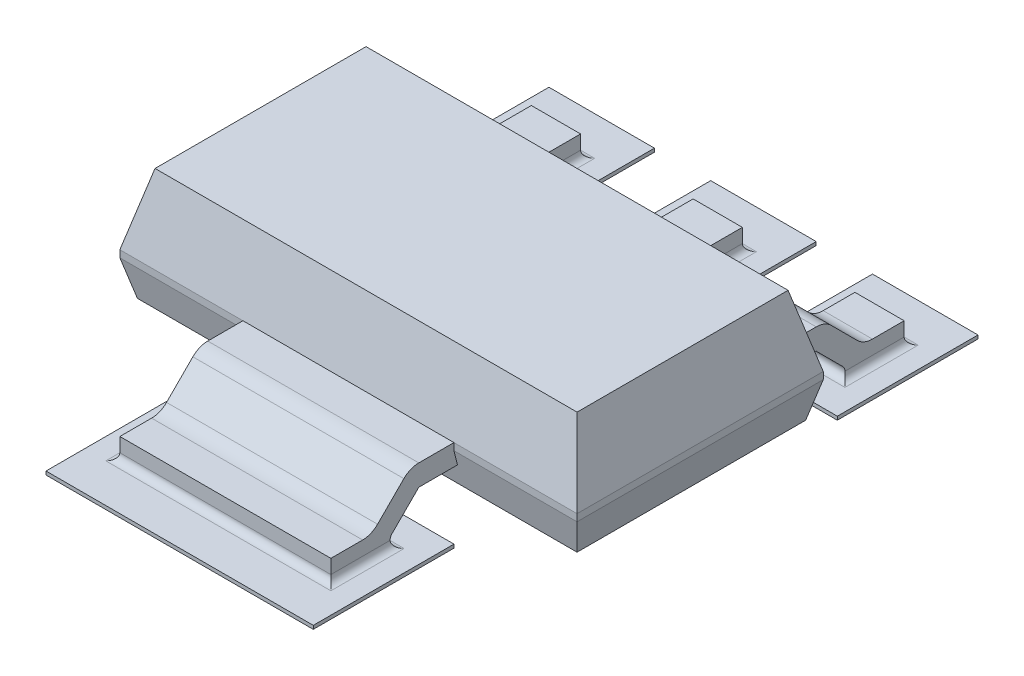
from build123d import *
from OCP.BRepFilletAPI import BRepFilletAPI_MakeChamfer

# Parameters (mm, degrees)
BOSS_EXTRUDE1_DEPTH   = 1.6
CHAMFER1_SIZE         = 1
CHAMFER1_SIZE2        = 0.25
CHAMFER2_SIZE         = 0.125
CHAMFER2_SIZE2        = 0.5
EXTRUDE_THIN1_DEPTH   = 1.5
EXTRUDE_THIN2_DEPTH   = 0.35
BOSS_EXTRUDE2_DEPTH   = 0.05
FILLET1_R             = 0.1
FILLET2_R             = 0.1
LPATTERN1_START       = -2.75
LPATTERN1_DEPTH       = 0.9
LPATTERN1_START_2     = -3.05
LPATTERN1_2_OUTLINE_W = 0.04999999999999999
LPATTERN1_2_OUTLINE_H = 2.0000000000000004
LPATTERN1_2_DEPTH     = 1.5
LPATTERN1_START_3     = -5
LPATTERN1_3_DEPTH     = 5
LPATTERN1_START_4     = -0.45
LPATTERN1_4_DEPTH     = 0.9
LPATTERN1_START_5     = -0.75
LPATTERN1_5_OUTLINE_W = 0.04999999999999999
LPATTERN1_5_OUTLINE_H = 2.0000000000000004
LPATTERN1_5_DEPTH     = 1.5
LPATTERN1_6_DEPTH     = 5
INDENT1_START         = -1.5
INDENT1_DEPTH         = 3
INDENT1_START_2       = -2.65
INDENT1_2_DEPTH       = 0.7
INDENT1_START_3       = -0.35
INDENT1_3_DEPTH       = 0.7
INDENT1_START_4       = 1.95
INDENT1_4_DEPTH       = 0.7


with BuildPart() as part:
    # Sketch1 → Boss-Extrude1 (new body)
    with BuildSketch(Plane(origin=(0, 0, 0), x_dir=(1, 0, 0), z_dir=(0, 1, 0))):
        Polygon((-3.2500000000000004, 1.7500000000000002), (3.2499999999999996, 1.7500000000000002), (3.25, -1.75), (-3.2500000000000004, -1.749999999999998), align=None)
    extrude(amount=BOSS_EXTRUDE1_DEPTH)

    # Chamfer1: one chamfer whose edges measure the first distance from different faces: ONE call of the kernel's chamfer builder (chamfer() names one face for all edges)
    chamfer1_edges_1 = [part.edges().sort_by_distance(p)[0] for p in [
        (-3.2500000000000004, 1.6, -1.11e-15),
    ]]
    chamfer1_side_1 = [part.faces().sort_by_distance(p)[0] for p in [
        (-3.2500000000000004, 0.8, -1.17e-15),
    ]]
    chamfer1_edges_2 = [part.edges().sort_by_distance(p)[0] for p in [
        (0, 1.6, 1.7499999999999991),
    ]]
    chamfer1_side_2 = [part.faces().sort_by_distance(p)[0] for p in [
        (-6e-17, 0.8, 1.7499999999999991),
    ]]
    chamfer1_edges_3 = [part.edges().sort_by_distance(p)[0] for p in [
        (3.25, 1.6, -2.2e-16),
    ]]
    chamfer1_side_3 = [part.faces().sort_by_distance(p)[0] for p in [
        (3.25, 0.8, -1.6e-16),
    ]]
    chamfer1_edges_4 = [part.edges().sort_by_distance(p)[0] for p in [
        (-4.4e-16, 1.6, -1.7500000000000002),
    ]]
    chamfer1_side_4 = [part.faces().sort_by_distance(p)[0] for p in [
        (-4.3e-16, 0.8, -1.7500000000000002),
    ]]
    chamfer1 = BRepFilletAPI_MakeChamfer(part.part.solid().wrapped)
    for e in chamfer1_edges_1:
        chamfer1.Add(CHAMFER1_SIZE, CHAMFER1_SIZE2, e.wrapped, chamfer1_side_1[0].wrapped)  # the first distance lies on this face
    for e in chamfer1_edges_2:
        chamfer1.Add(CHAMFER1_SIZE, CHAMFER1_SIZE2, e.wrapped, chamfer1_side_2[0].wrapped)  # the first distance lies on this face
    for e in chamfer1_edges_3:
        chamfer1.Add(CHAMFER1_SIZE, CHAMFER1_SIZE2, e.wrapped, chamfer1_side_3[0].wrapped)  # the first distance lies on this face
    for e in chamfer1_edges_4:
        chamfer1.Add(CHAMFER1_SIZE, CHAMFER1_SIZE2, e.wrapped, chamfer1_side_4[0].wrapped)  # the first distance lies on this face
    add(Compound.cast(chamfer1.Shape()), mode=Mode.REPLACE)

    # Chamfer2
    chamfer2_edges = [part.edges().sort_by_distance(p)[0] for p in [
        (0, 0, 1.7499999999999991),
        (-3.2500000000000004, 0, -1.11e-15),
        (-4.4e-16, 0, -1.7500000000000002),
        (3.25, 0, -2.2e-16),
    ]]
    chamfer2_side = [part.faces().sort_by_distance(p)[0] for p in [
        (4e-17, 0, -5.8e-16),
    ]]
    chamfer(chamfer2_edges, length=CHAMFER2_SIZE, length2=CHAMFER2_SIZE2, reference=chamfer2_side[0])

    # Indent1: read off the stored shape, not the designer's step
    # Indent1 outline → Indent1 (cut)
    with BuildSketch(Plane.YZ.offset(INDENT1_START)):
        Polygon((0.3, 0), (0.6, 0), (0.6, 1.75), (0.5, 1.75), (0.3, 1.7), align=None)
    extrude(amount=INDENT1_DEPTH, mode=Mode.SUBTRACT)

    # Indent1 2 outline → Indent1 2 (cut)
    with BuildSketch(Plane.YZ.offset(INDENT1_START_2)):
        Polygon((0.5, -1.75), (0.6, -1.75), (0.6, 0), (0.3, 0), (0.3, -1.7), align=None)
    extrude(amount=INDENT1_2_DEPTH, mode=Mode.SUBTRACT)

    # Indent1 3 outline → Indent1 3 (cut)
    with BuildSketch(Plane.YZ.offset(INDENT1_START_3)):
        Polygon((0.5, -1.75), (0.6, -1.75), (0.6, 0), (0.3, 0), (0.3, -1.7), align=None)
    extrude(amount=INDENT1_3_DEPTH, mode=Mode.SUBTRACT)

    # Indent1 4 outline → Indent1 4 (cut)
    with BuildSketch(Plane.YZ.offset(INDENT1_START_4)):
        Polygon((0.5, -1.75), (0.6, -1.75), (0.6, 0), (0.3, 0), (0.3, -1.7), align=None)
    extrude(amount=INDENT1_4_DEPTH, mode=Mode.SUBTRACT)


with BuildPart() as body_2:
    # Sketch2 → Extrude-Thin1 (new, symmetric)
    with BuildSketch(Plane(origin=(0, 0, 0), x_dir=(0, 0, -1), z_dir=(1, 0, 0))):
        with BuildLine():
            Line((0, 0.6), (-2.25, 0.5999999999999998))
            ThreePointArc((-2.25, 0.5999999999999998), (-2.3648050297095278, 0.577163859753389), (-2.4621320343559647, 0.5121320343559638))
            Line((-2.4621320343559647, 0.5121320343559638), (-2.836396103067891, 0.13786796564403583))
            ThreePointArc((-2.836396103067891, 0.13786796564403583), (-2.9337231077143313, 0.07283614024661894), (-3.048528137423855, 0.04999999999999964))
            Line((-3.048528137423855, 0.04999999999999964), (-3.5, 0.04999999999999957))
            Line((-3.5, 0.04999999999999957), (-3.5, -0.25000000000000044))
            Line((-3.5, -0.25000000000000044), (-3.048528137423855, -0.25000000000000033))
            ThreePointArc((-3.048528137423839, -0.2500000000000004), (-2.8189180780047915, -0.20432771950676182), (-2.6242640687119105, -0.07426406871192798))
            Line((-2.624264068711926, -0.07426406871192787), (-2.25, 0.30000000000000004))
            Line((-2.25, 0.29999999999999977), (3e-17, 0.3))
            Line((3e-17, 0.3), (0, 0.6))
        make_face()
    extrude(amount=EXTRUDE_THIN1_DEPTH, both=True)



with BuildPart() as body_3:
    # Sketch3 → Extrude-Thin2 (new, symmetric)
    with BuildSketch(Plane(origin=(2.3, 0, 0), x_dir=(0, 0, -1), z_dir=(1, 0, 0))):
        with BuildLine():
            Line((0, 0.6), (2.25, 0.5999999999999998))
            ThreePointArc((2.25, 0.5999999999999998), (2.364805029709526, 0.5771638597533844), (2.4621320343559647, 0.5121320343559636))
            Line((2.4621320343559647, 0.5121320343559636), (2.836396103067891, 0.13786796564403606))
            ThreePointArc((2.836396103067891, 0.13786796564403606), (2.933723107714331, 0.0728361402466185), (3.048528137423855, 0.05000000000000013))
            Line((3.048528137423855, 0.05000000000000013), (3.5, 0.05000000000000001))
            Line((3.5, 0.05000000000000001), (3.5, -0.24999999999999997))
            Line((3.5, -0.24999999999999997), (3.048528137423855, -0.24999999999999986))
            ThreePointArc((3.0485281374238418, -0.24999999999999994), (2.8189180780047933, -0.20432771950676315), (2.6242640687119128, -0.07426406871192781))
            Line((2.624264068711926, -0.07426406871192778), (2.25, 0.2999999999999997))
            Line((2.25, 0.29999999999999977), (-3e-17, 0.3))
            Line((-3e-17, 0.3), (0, 0.6))
        make_face()
    extrude(amount=EXTRUDE_THIN2_DEPTH, both=True)


with BuildPart() as body_2_1:
    add(body_2.part)

    add(body_3.part)  # Boss-Extrude2 merges body 3
    # Sketch4 → Boss-Extrude2 (add)
    with BuildSketch(Plane.XZ.offset(0.24999999999999903)):
        Polygon((1.5499999999999998, -2.1499999999999995), (3.05, -2.1499999999999995), (3.05, -4.1499999999999995), (1.55, -4.1499999999999995), align=None)
        Polygon((-1.8999999999999984, 4.1499999999999995), (1.9000000000000012, 4.15), (1.9000000000000017, 2.149999999999999), (-1.8999999999999984, 2.149999999999999), align=None)
    extrude(amount=BOSS_EXTRUDE2_DEPTH)

    # Fillet1
    fillet1_edges = [body_2_1.edges().sort_by_distance(p)[0] for p in [
        (1.9499999999999997, -0.24999999999999992, -3.2742640687119273),
        (2.3, -0.2499999999999999, -3.0485281374238484),
        (2.3, -0.24999999999999997, -3.5),
        (2.65, -0.24999999999999992, -3.2742640687119273),
    ]]
    fillet(fillet1_edges, radius=FILLET1_R)

    # Fillet2
    fillet2_edges = [body_2_1.edges().sort_by_distance(p)[0] for p in [
        (1.5, -0.2500000000000004, 3.2742640687119273),
        (-1.5, -0.2500000000000004, 3.2742640687119273),
        (0, -0.25000000000000033, 3.048528137423847),
        (0, -0.25000000000000044, 3.5),
    ]]
    fillet(fillet2_edges, radius=FILLET2_R)


with BuildPart() as body_3_2:
    # LPattern1: read off the stored shape, not the designer's step
    # LPattern1 outline → LPattern1 (new body)
    with BuildSketch(Plane.YZ.offset(LPATTERN1_START)):
        with BuildLine():
            ThreePointArc((-0.25, -3.6), (-0.220710678, -3.529289322), (-0.15, -3.5))
            Line((-0.15, -3.5), (0.05, -3.5))
            Line((0.05, -3.5), (0.05, -3.048528137))
            ThreePointArc((0.05, -3.048528137), (0.07283614, -2.933723107), (0.137867966, -2.836396103))
            Line((0.137867966, -2.836396103), (0.512132034, -2.462132034))
            ThreePointArc((0.512132034, -2.462132034), (0.57716386, -2.36480503), (0.6, -2.25))
            Line((0.6, -2.25), (0.6, 0))
            Line((0.6, 0), (0.3, 0))
            Line((0.3, 0), (0.3, -2.25))
            Line((0.3, -2.25), (-0.074264069, -2.624264069))
            ThreePointArc((-0.074264069, -2.624264069), (-0.076423299, -2.626434345), (-0.078571429, -2.62861561))
            ThreePointArc((-0.078571429, -2.62861561), (-0.187796447, -2.651212199), (-0.25, -2.558630189))
            Line((-0.25, -2.558630189), (-0.25, -2.15))
            Line((-0.25, -2.15), (-0.3, -2.15))
            Line((-0.3, -2.15), (-0.3, -4.15))
            Line((-0.3, -4.15), (-0.25, -4.15))
            Line((-0.25, -4.15), (-0.25, -3.6))
        make_face()
    extrude(amount=LPATTERN1_DEPTH)

    # LPattern1 2 outline → LPattern1 2 (add)
    with BuildSketch(Plane.YZ.offset(LPATTERN1_START_2)):
        with Locations((-0.275, -3.1500000000000004)):
            Rectangle(LPATTERN1_2_OUTLINE_W, LPATTERN1_2_OUTLINE_H)
    extrude(amount=LPATTERN1_2_DEPTH)

    # LPattern1 3 outline → LPattern1 3 (cut)
    with BuildSketch(Plane.XY.offset(LPATTERN1_START_3)):
        with BuildLine():
            ThreePointArc((-1.95, -0.15), (-1.920710678, -0.220710678), (-1.85, -0.25))
            Line((-1.85, -0.25), (-1.85, 0.6))
            Line((-1.85, 0.6), (-1.95, 0.6))
            Line((-1.95, 0.6), (-1.95, -0.15))
        make_face()
        with BuildLine():
            ThreePointArc((-2.75, -0.25), (-2.679289322, -0.220710678), (-2.65, -0.15))
            Line((-2.65, -0.15), (-2.65, 0.6))
            Line((-2.65, 0.6), (-2.75, 0.6))
            Line((-2.75, 0.6), (-2.75, -0.25))
        make_face()
    extrude(amount=LPATTERN1_3_DEPTH, mode=Mode.SUBTRACT)


with BuildPart() as body_4:
    # LPattern1 4 outline → LPattern1 4 (new body)
    with BuildSketch(Plane.YZ.offset(LPATTERN1_START_4)):
        with BuildLine():
            ThreePointArc((-0.25, -3.6), (-0.220710678, -3.529289322), (-0.15, -3.5))
            Line((-0.15, -3.5), (0.05, -3.5))
            Line((0.05, -3.5), (0.05, -3.048528137))
            ThreePointArc((0.05, -3.048528137), (0.07283614, -2.933723107), (0.137867966, -2.836396103))
            Line((0.137867966, -2.836396103), (0.512132034, -2.462132034))
            ThreePointArc((0.512132034, -2.462132034), (0.57716386, -2.36480503), (0.6, -2.25))
            Line((0.6, -2.25), (0.6, 0))
            Line((0.6, 0), (0.3, 0))
            Line((0.3, 0), (0.3, -2.25))
            Line((0.3, -2.25), (-0.074264069, -2.624264069))
            ThreePointArc((-0.074264069, -2.624264069), (-0.076423299, -2.626434345), (-0.078571429, -2.62861561))
            ThreePointArc((-0.078571429, -2.62861561), (-0.187796447, -2.651212199), (-0.25, -2.558630189))
            Line((-0.25, -2.558630189), (-0.25, -2.15))
            Line((-0.25, -2.15), (-0.3, -2.15))
            Line((-0.3, -2.15), (-0.3, -4.15))
            Line((-0.3, -4.15), (-0.25, -4.15))
            Line((-0.25, -4.15), (-0.25, -3.6))
        make_face()
    extrude(amount=LPATTERN1_4_DEPTH)

    # LPattern1 5 outline → LPattern1 5 (add)
    with BuildSketch(Plane.YZ.offset(LPATTERN1_START_5)):
        with Locations((-0.275, -3.1500000000000004)):
            Rectangle(LPATTERN1_5_OUTLINE_W, LPATTERN1_5_OUTLINE_H)
    extrude(amount=LPATTERN1_5_DEPTH)

    # LPattern1 6 outline → LPattern1 6 (cut)
    with BuildSketch(Plane.XY.offset(LPATTERN1_START_3)):
        with BuildLine():
            ThreePointArc((0.35, -0.15), (0.379289322, -0.220710678), (0.45, -0.25))
            Line((0.45, -0.25), (0.45, 0.6))
            Line((0.45, 0.6), (0.35, 0.6))
            Line((0.35, 0.6), (0.35, -0.15))
        make_face()
        with BuildLine():
            ThreePointArc((-0.45, -0.25), (-0.379289322, -0.220710678), (-0.35, -0.15))
            Line((-0.35, -0.15), (-0.35, 0.6))
            Line((-0.35, 0.6), (-0.45, 0.6))
            Line((-0.45, 0.6), (-0.45, -0.25))
        make_face()
    extrude(amount=LPATTERN1_6_DEPTH, mode=Mode.SUBTRACT)


solid = Compound([part.part, body_2_1.part, body_3_2.part, body_4.part])
